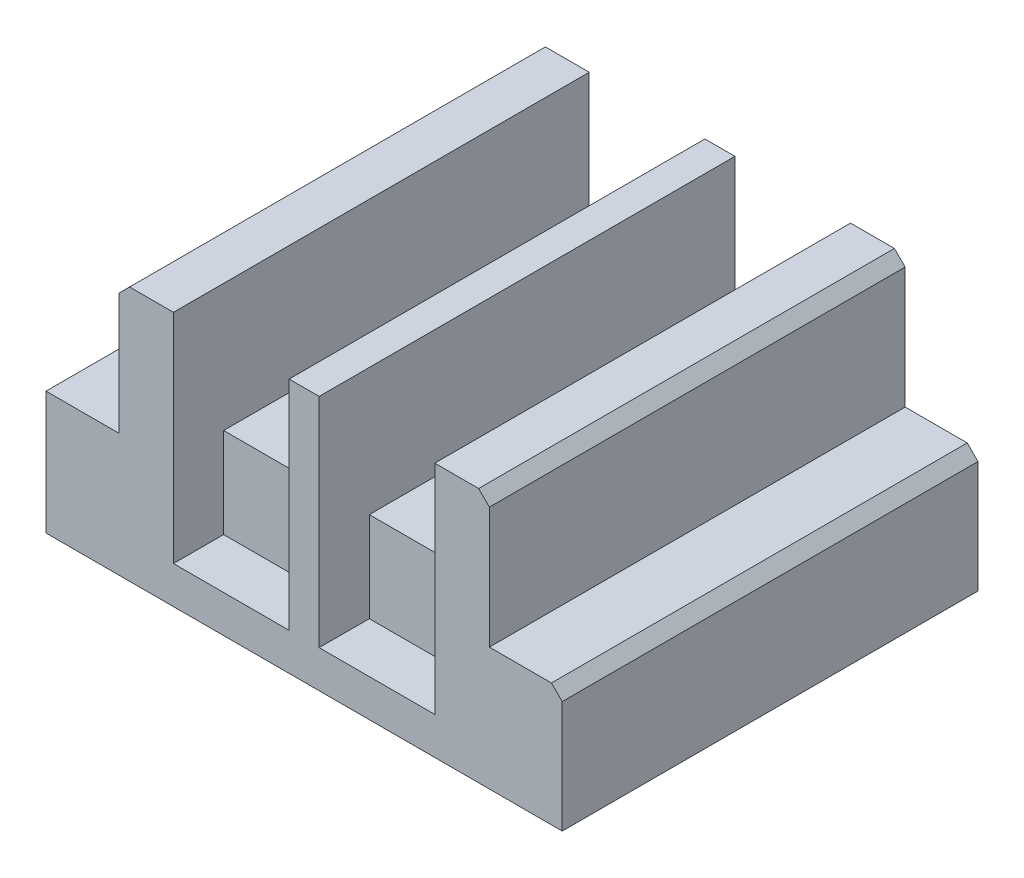
from build123d import *

# Parameters (mm, degrees)
EXTRUDE_1_DEPTH        = 23.706666667
SKETCH_2_W             = 6.773333333
SKETCH_2_H             = 38.666666667
CUT_EXTRUDE_1_DEPTH    = 12.276666667
CHAMFER_1_SIZE         = 1
SKETCH_3_W             = 10.752666667
SKETCH_3_H             = 38.666666667
CUT_EXTRUDE_2_DEPTH    = 11.853333333
SKETCH_4_W             = 10.752666667
SKETCH_4_H             = 4.666666667
CUT_EXTRUDE_3_DEPTH    = 8.382
SKETCH_5_R             = 2.5
CUT_EXTRUDE_4_DEPTH    = 10
SKETCH_6_W             = 10.752666667
SKETCH_6_H             = 7.62
CUT_EXTRUDE_5_DEPTH    = 3
MIRROR_START           = 11.853333334
MIRROR_2_OUTLINE_W     = 10.752666667
MIRROR_2_OUTLINE_H     = 38.666666667
MIRROR_2_DEPTH         = 11.853333333
MIRROR_START_2         = 3.471333334
MIRROR_2_2_OUTLINE_W   = 10.752666667
MIRROR_2_2_OUTLINE_H   = 4.666666667
MIRROR_2_2_OUTLINE_H_2 = 4.666666668
MIRROR_2_2_OUTLINE_R   = 2.5
MIRROR_2_2_DEPTH       = 8.382
MIRROR_START_3         = 8.853333334
MIRROR_2_3_OUTLINE_W   = 10.752666667
MIRROR_2_3_OUTLINE_H   = 7.62
MIRROR_2_3_DEPTH       = 3
MIRROR_START_4         = 1.853333334
MIRROR_2_4_OUTLINE_R   = 2.5
MIRROR_2_4_DEPTH       = 1.618
MIRROR_START_5         = -19.333333333
MIRROR_2_5_DEPTH       = 38.666666667


# Read off the part's stored shape, not the designer's step: ﾐﾗｰ2
with BuildPart() as part:
    # ｽｹｯﾁ1 → ﾎﾞｽ - 押し出し1 (new body)
    with BuildSketch(Plane(origin=(0, 0, 0), x_dir=(1, 0, 0), z_dir=(0, 1, 0))):
        Polygon((-24.003333333, 19.333333333), (24.003333334, 19.333333333), (24.003333333, -19.333333334), (-24.003333333, -19.333333334), align=None)
    extrude(amount=EXTRUDE_1_DEPTH)

    # ｽｹｯﾁ2 → ｶｯﾄ - 押し出し1 (cut)
    with BuildSketch(Plane(origin=(0, 23.706666667, 0), x_dir=(1, 0, 0), z_dir=(0, 1, 0))):
        with Locations((20.616666667, -1e-09)):
            Rectangle(SKETCH_2_W, SKETCH_2_H)
    extrude(amount=-CUT_EXTRUDE_1_DEPTH, mode=Mode.SUBTRACT)

    # 面取り1
    chamfer_1_edges = [part.edges().sort_by_distance(p)[0] for p in [
        (24.003333334, 11.43, 0),
        (17.230000001, 23.706666667, 0),
    ]]
    chamfer(chamfer_1_edges, length=CHAMFER_1_SIZE)

    # ｽｹｯﾁ3 → ｶｯﾄ - 押し出し2 (cut)
    with BuildSketch(Plane(origin=(0, 23.706666667, 0), x_dir=(1, 0, 0), z_dir=(0, 1, 0))):
        with Locations((6.773666668, -1e-09)):
            Rectangle(SKETCH_3_W, SKETCH_3_H)
    extrude(amount=-CUT_EXTRUDE_2_DEPTH, mode=Mode.SUBTRACT)

    # ｽｹｯﾁ4 → ｶｯﾄ - 押し出し3 (cut)
    with BuildSketch(Plane(origin=(0, 11.853333334, 0), x_dir=(1, 0, 0), z_dir=(0, 1, 0))):
        with Locations((6.773666668, 17)):
            Rectangle(SKETCH_4_W, SKETCH_4_H)
    cut_extrude_3 = extrude(amount=-CUT_EXTRUDE_3_DEPTH, mode=Mode.SUBTRACT)

    # ｽｹｯﾁ5 → ｶｯﾄ - 押し出し4 (cut)
    with BuildSketch(Plane(origin=(0, 11.853333334, 0), x_dir=(1, 0, 0), z_dir=(0, 1, 0))):
        with Locations(Location((6.773666667, 9.593333333, 0), (0, 0, 270))):
            Circle(SKETCH_5_R)
    cut_extrude_4 = extrude(amount=-CUT_EXTRUDE_4_DEPTH, mode=Mode.SUBTRACT)

    # ﾐﾗｰ1: ｶｯﾄ - 押し出し3, ｶｯﾄ - 押し出し4 across plane
    add(cut_extrude_3.mirror(Plane.XY), mode=Mode.SUBTRACT)
    add(cut_extrude_4.mirror(Plane.XY), mode=Mode.SUBTRACT)

    # ｽｹｯﾁ6 → ｶｯﾄ - 押し出し5 (cut)
    with BuildSketch(Plane(origin=(0, 11.853333334, 0), x_dir=(1, 0, 0), z_dir=(0, 1, 0))):
        with Locations((6.773666668, 0.283333333)):
            Rectangle(SKETCH_6_W, SKETCH_6_H)
    extrude(amount=-CUT_EXTRUDE_5_DEPTH, mode=Mode.SUBTRACT)

    # ﾐﾗｰ2 outline → ﾐﾗｰ2 (cut)
    with BuildSketch(Plane(origin=(0, 0, 0), x_dir=(1, 0, 0), z_dir=(0, 1, 0)).offset(MIRROR_START)):
        with Locations((-6.773666668, -1e-09)):
            Rectangle(MIRROR_2_OUTLINE_W, MIRROR_2_OUTLINE_H)
    extrude(amount=MIRROR_2_DEPTH, mode=Mode.SUBTRACT)

    # Mirror 2 2 outline → Mirror 2 2 (cut)
    with BuildSketch(Plane(origin=(0, 0, 0), x_dir=(1, 0, 0), z_dir=(0, 1, 0)).offset(MIRROR_START_2)):
        with Locations((-6.773666668, 17)):
            Rectangle(MIRROR_2_2_OUTLINE_W, MIRROR_2_2_OUTLINE_H)
        with Locations((-6.773666668, -17)):
            Rectangle(MIRROR_2_2_OUTLINE_W, MIRROR_2_2_OUTLINE_H_2)
        with Locations((-6.773666667, 9.593333333)):
            Circle(MIRROR_2_2_OUTLINE_R)
        with Locations((-6.773666667, -9.593333333)):
            Circle(MIRROR_2_2_OUTLINE_R)
    extrude(amount=MIRROR_2_2_DEPTH, mode=Mode.SUBTRACT)

    # Mirror 2 3 outline → Mirror 2 3 (cut)
    with BuildSketch(Plane(origin=(0, 0, 0), x_dir=(1, 0, 0), z_dir=(0, 1, 0)).offset(MIRROR_START_3)):
        with Locations((-6.773666668, 0.283333333)):
            Rectangle(MIRROR_2_3_OUTLINE_W, MIRROR_2_3_OUTLINE_H)
    extrude(amount=MIRROR_2_3_DEPTH, mode=Mode.SUBTRACT)

    # Mirror 2 4 outline → Mirror 2 4 (cut)
    with BuildSketch(Plane(origin=(0, 0, 0), x_dir=(1, 0, 0), z_dir=(0, 1, 0)).offset(MIRROR_START_4)):
        with Locations((-6.773666667, 9.593333333)):
            Circle(MIRROR_2_4_OUTLINE_R)
        with Locations((-6.773666667, -9.593333333)):
            Circle(MIRROR_2_4_OUTLINE_R)
    extrude(amount=MIRROR_2_4_DEPTH, mode=Mode.SUBTRACT)

    # Mirror 2 5 outline → Mirror 2 5 (cut)
    with BuildSketch(Plane.XY.offset(MIRROR_START_5)):
        Polygon((-24.003333333, 23.706666667), (-24.003333333, 11.43), (-17.230000001, 11.43), (-17.230000001, 22.706666667), (-16.230000001, 23.706666667), align=None)
    extrude(amount=MIRROR_2_5_DEPTH, mode=Mode.SUBTRACT)


solid = part.part
